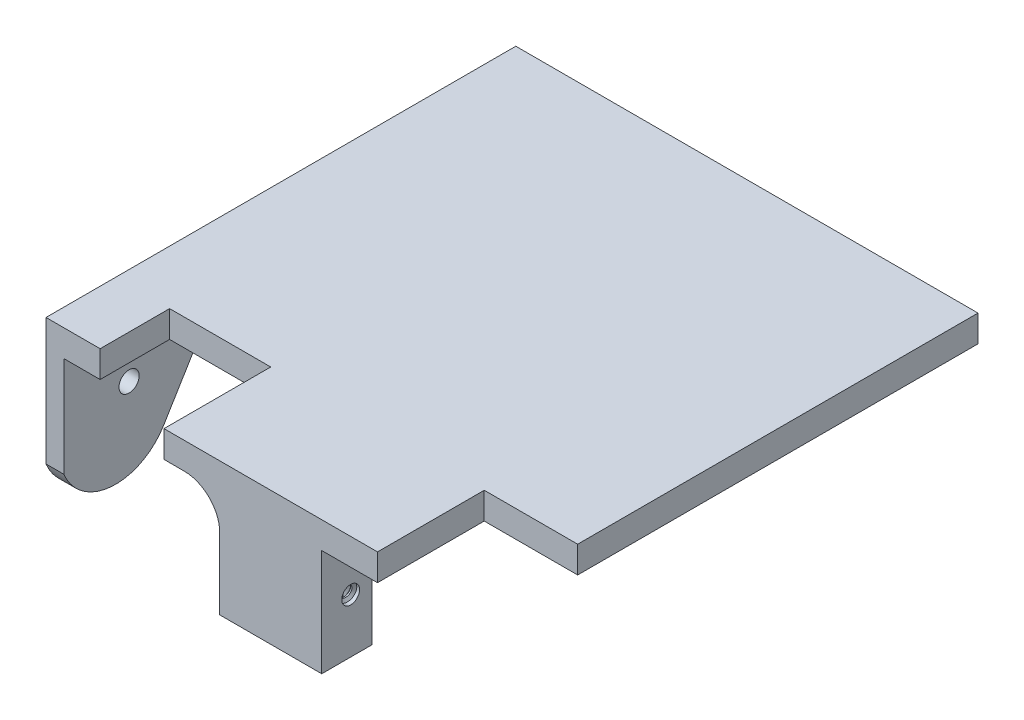
from build123d import *

# Parameters (mm, degrees)
EXTRUDE_1_DEPTH     = 3
SKETCH_2_W          = 5.733605027
SKETCH_2_H          = 5.629998203
EXTRUDE_2_DEPTH     = 12
FILLET_2_R          = 4
EXTRUDE_3_DEPTH     = 12
FILLET_3_R          = 4
SKETCH_7_R          = 1
CUT_EXTRUDE_1_DEPTH = 2
THREAD_1_PITCH      = 0.635
SKETCH_17_R         = 1
CUT_EXTRUDE_2_DEPTH = 2
THREAD_2_PITCH      = 0.635
SKETCH_6_R          = 1.132443996
EXTRUDE_4_DEPTH     = 2


with BuildPart() as part:
    # Sketch 1 → 凸台-拉伸1 (new body)
    with BuildSketch(Plane(origin=(0, 0, 0), x_dir=(1, 0, 0), z_dir=(0, 1, 0))):
        Polygon((-23.368095001, -22.5), (-12, -22.5), (-12, -34.5), (0, -34.5), (12, -34.5), (12, -22.5), (22.5, -22.5), (22.5, 22.5), (-29.452992198, 22.5), (-29.452992198, -22.5), (-29.452992198, -30.308375292), (-23.368095001, -30.308375292), align=None)
    extrude(amount=-EXTRUDE_1_DEPTH)

    # Sketch 2 → 凸台-拉伸2 (add)
    with BuildSketch(Plane.XZ.offset(3)):
        with Locations((-2.866802514, 31.685000899)):
            Rectangle(SKETCH_2_W, SKETCH_2_H)
        with Locations((2.866802514, 31.685000899)):
            Rectangle(SKETCH_2_W, SKETCH_2_H)
    extrude(amount=EXTRUDE_2_DEPTH)

    # 圆角2
    fillet_2_edges = [part.edges().sort_by_distance(p)[0] for p in [
        (-5.733605027, -3, 31.685000898),
    ]]
    fillet(fillet_2_edges, radius=FILLET_2_R)

    # 草图4 → 凸台-拉伸3 (add)
    with BuildSketch(Plane.XZ.offset(3)):
        Polygon((5.733605027, 6.370001797), (-2, 6.370001797), (-2, 1.670001797), (-2, -1.243194227), (5.733605027, -1.243194227), (5.733605027, 1.670001797), align=None)
    extrude(amount=EXTRUDE_3_DEPTH)

    # 圆角3
    fillet_3_edges = [part.edges().sort_by_distance(p)[0] for p in [
        (-2, -3, 2.563403785),
    ]]
    fillet(fillet_3_edges, radius=FILLET_3_R)

    # 草图7 → 切除-拉伸1 (cut)
    with BuildSketch(Plane(origin=(5.733605027, 0, 0), x_dir=(0, 0, -1), z_dir=(1, 0, 0))):
        with Locations((-3.991006225, -8.919683491)):
            Circle(SKETCH_7_R)
    extrude(amount=-CUT_EXTRUDE_1_DEPTH, mode=Mode.SUBTRACT)

    # 螺纹线1: the profile of Sketch 1 2 profile screwed along a right-hand helix of 3.149606 turns, 6 arcs to a turn; built about Z, then put on its axis
    thread_1_z = Axis((0, 0, 0), (0, 0, 1))
    thread_1_corners = [(1.0003, 0, -0.000173205), (1.0003, 0, 0.555798203), (0.65629617, 0, 0.357187499), (0.65629617, 0, 0.198437499)]
    with BuildLine(mode=Mode.PRIVATE) as thread_1_profile:
        Line(thread_1_corners[0], thread_1_corners[1])
        Line(thread_1_corners[1], thread_1_corners[2])
        Line(thread_1_corners[2], thread_1_corners[3])
        Line(thread_1_corners[3], thread_1_corners[0])
    thread_1_cap = Face(thread_1_profile.wire())
    thread_1_turn_angles = [0, 30, 60, 90, 120, 150, 180, 210, 240, 270, 300, 330, 360]
    thread_1_turn_weights = [1, 0.8660254037844387, 1, 0.8660254037844387, 1, 0.8660254037844387, 1, 0.8660254037844387, 1, 0.8660254037844387, 1, 0.8660254037844387, 1]
    thread_1_turn_rails = [Edge.make_bspline([Vector(p[0], p[1], 0).rotate(thread_1_z, thread_1_turn_angles[k]) / thread_1_turn_weights[k] + Vector(0, 0, p[2] + THREAD_1_PITCH * thread_1_turn_angles[k] / 360) for k in range(13)], [0, 0, 0, 1, 1, 2, 2, 3, 3, 4, 4, 5, 5, 6, 6, 6], 2, thread_1_turn_weights) for p in thread_1_corners]
    thread_1_turn_sides = [Face.make_surface_from_curves(thread_1_turn_rails[p[0]], thread_1_turn_rails[p[1]]) for p in [(0, 1), (1, 2), (2, 3), (3, 0)]]
    thread_1_last_angles = [1080, 1106.929133858, 1133.858267717]
    thread_1_last_weights = [1, 0.8915673595333442, 1]
    thread_1_last_rails = [Edge.make_bspline([Vector(p[0], p[1], 0).rotate(thread_1_z, thread_1_last_angles[k]) / thread_1_last_weights[k] + Vector(0, 0, p[2] + THREAD_1_PITCH * thread_1_last_angles[k] / 360) for k in range(3)], [0, 0, 0, 1, 1, 1], 2, thread_1_last_weights) for p in thread_1_corners]
    thread_1_last_sides = [Face.make_surface_from_curves(thread_1_last_rails[p[0]], thread_1_last_rails[p[1]]) for p in [(0, 1), (1, 2), (2, 3), (3, 0)]]
    thread_1 = Plane(origin=(5.733605027, -8.919683491, 3.991006225), x_dir=(0, 0, 1), z_dir=(-1, 0, 0)) * Solid(Shell([*[p.moved(Location((0, 0, THREAD_1_PITCH * i))) for i in range(3) for p in thread_1_turn_sides], *thread_1_last_sides, thread_1_cap, thread_1_cap.rotate(thread_1_z, 1133.858267717).moved(Location((0, 0, THREAD_1_PITCH * 1133.858267717 / 360)))]))
    add(thread_1)

    # 草图17 → 切除-拉伸2 (cut)
    with BuildSketch(Plane(origin=(5.733605027, 0, 0), x_dir=(0, 0, -1), z_dir=(1, 0, 0))):
        with Locations((-31.248997368, -8.919683491)):
            Circle(SKETCH_17_R)
    extrude(amount=-CUT_EXTRUDE_2_DEPTH, mode=Mode.SUBTRACT)

    # 螺纹线2: the profile of Sketch 2 2 profile screwed along a right-hand helix of 3.149606 turns, 6 arcs to a turn; built about Z, then put on its axis
    thread_2_z = Axis((0, 0, 0), (0, 0, 1))
    thread_2_corners = [(1.0003, 0, -0.000173205), (1.0003, 0, 0.555798203), (0.65629617, 0, 0.357187499), (0.65629617, 0, 0.198437499)]
    with BuildLine(mode=Mode.PRIVATE) as thread_2_profile:
        Line(thread_2_corners[0], thread_2_corners[1])
        Line(thread_2_corners[1], thread_2_corners[2])
        Line(thread_2_corners[2], thread_2_corners[3])
        Line(thread_2_corners[3], thread_2_corners[0])
    thread_2_cap = Face(thread_2_profile.wire())
    thread_2_turn_angles = [0, 30, 60, 90, 120, 150, 180, 210, 240, 270, 300, 330, 360]
    thread_2_turn_weights = [1, 0.8660254037844387, 1, 0.8660254037844387, 1, 0.8660254037844387, 1, 0.8660254037844387, 1, 0.8660254037844387, 1, 0.8660254037844387, 1]
    thread_2_turn_rails = [Edge.make_bspline([Vector(p[0], p[1], 0).rotate(thread_2_z, thread_2_turn_angles[k]) / thread_2_turn_weights[k] + Vector(0, 0, p[2] + THREAD_2_PITCH * thread_2_turn_angles[k] / 360) for k in range(13)], [0, 0, 0, 1, 1, 2, 2, 3, 3, 4, 4, 5, 5, 6, 6, 6], 2, thread_2_turn_weights) for p in thread_2_corners]
    thread_2_turn_sides = [Face.make_surface_from_curves(thread_2_turn_rails[p[0]], thread_2_turn_rails[p[1]]) for p in [(0, 1), (1, 2), (2, 3), (3, 0)]]
    thread_2_last_angles = [1080, 1106.929133858, 1133.858267717]
    thread_2_last_weights = [1, 0.8915673595333442, 1]
    thread_2_last_rails = [Edge.make_bspline([Vector(p[0], p[1], 0).rotate(thread_2_z, thread_2_last_angles[k]) / thread_2_last_weights[k] + Vector(0, 0, p[2] + THREAD_2_PITCH * thread_2_last_angles[k] / 360) for k in range(3)], [0, 0, 0, 1, 1, 1], 2, thread_2_last_weights) for p in thread_2_corners]
    thread_2_last_sides = [Face.make_surface_from_curves(thread_2_last_rails[p[0]], thread_2_last_rails[p[1]]) for p in [(0, 1), (1, 2), (2, 3), (3, 0)]]
    thread_2 = Plane(origin=(5.733605027, -8.919683491, 31.248997368), x_dir=(0, 0, 1), z_dir=(-1, 0, 0)) * Solid(Shell([*[p.moved(Location((0, 0, THREAD_2_PITCH * i))) for i in range(3) for p in thread_2_turn_sides], *thread_2_last_sides, thread_2_cap, thread_2_cap.rotate(thread_2_z, 1133.858267717).moved(Location((0, 0, THREAD_2_PITCH * 1133.858267717 / 360)))]))
    add(thread_2)

    # 草图6 → 凸台-拉伸4 (add)
    with BuildSketch(Plane.ZY.offset(29.452992198)):
        with BuildLine():
            Line((30.308375292, -7), (30.308375292, -14.262212755))
            ThreePointArc((30.308375292, -14.262212755), (24.973241636, -18.143089901), (19.100945291, -15.136265297))
            Line((19.100945291, -15.136265297), (11.718358367, -3))
            Line((11.718358367, -3), (30.308375292, -3))
            Line((30.308375292, -3), (30.308375292, -7))
        make_face()
        with Locations((22.970001797, -8.9)):
            Circle(SKETCH_6_R, mode=Mode.SUBTRACT)
    extrude(amount=-EXTRUDE_4_DEPTH)


solid = part.part
